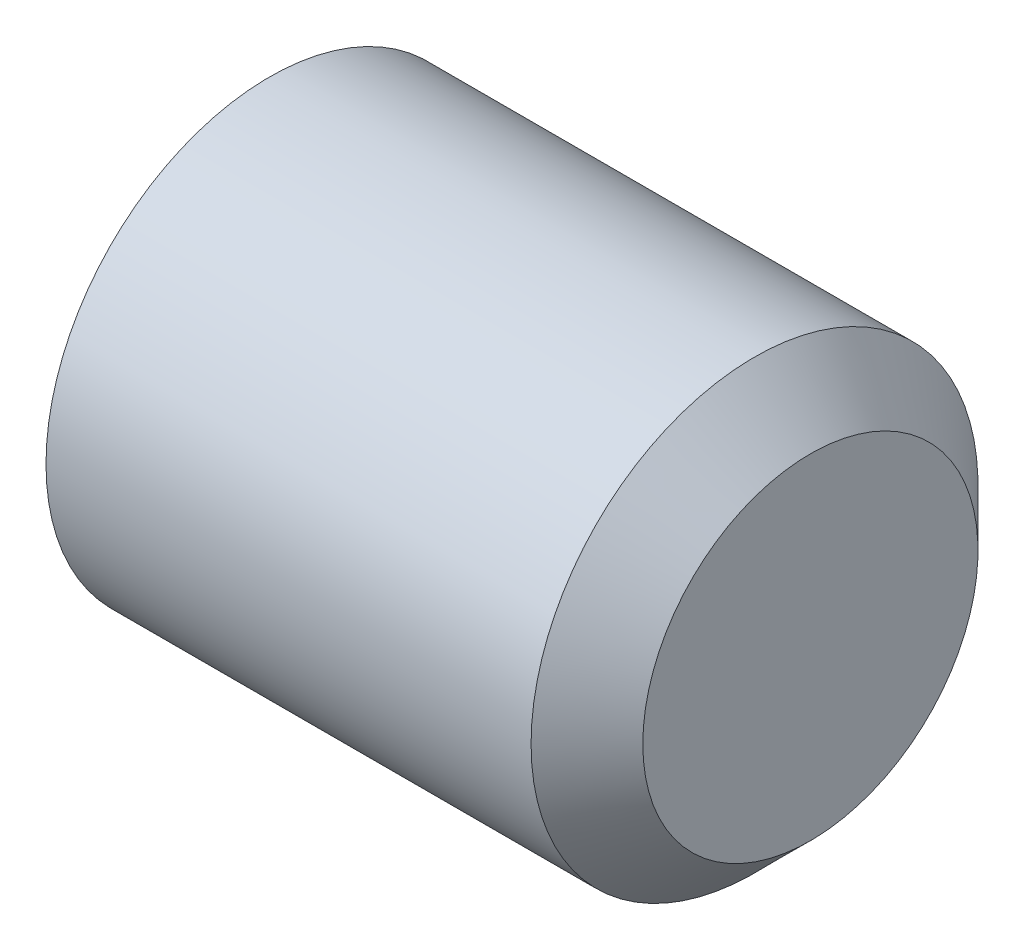
from build123d import *


with BuildPart() as part:
    # BodySke → BaseBody (revolve)
    with BuildSketch(Plane.XY):
        Polygon((0, 0), (0, 10.352), (0.951473244, 12), (27, 12), (30, 9), (30, 0), align=None)
    revolve(axis=Axis((-12.7, 0, 0), (1, 0, 0)))


solid = part.part
